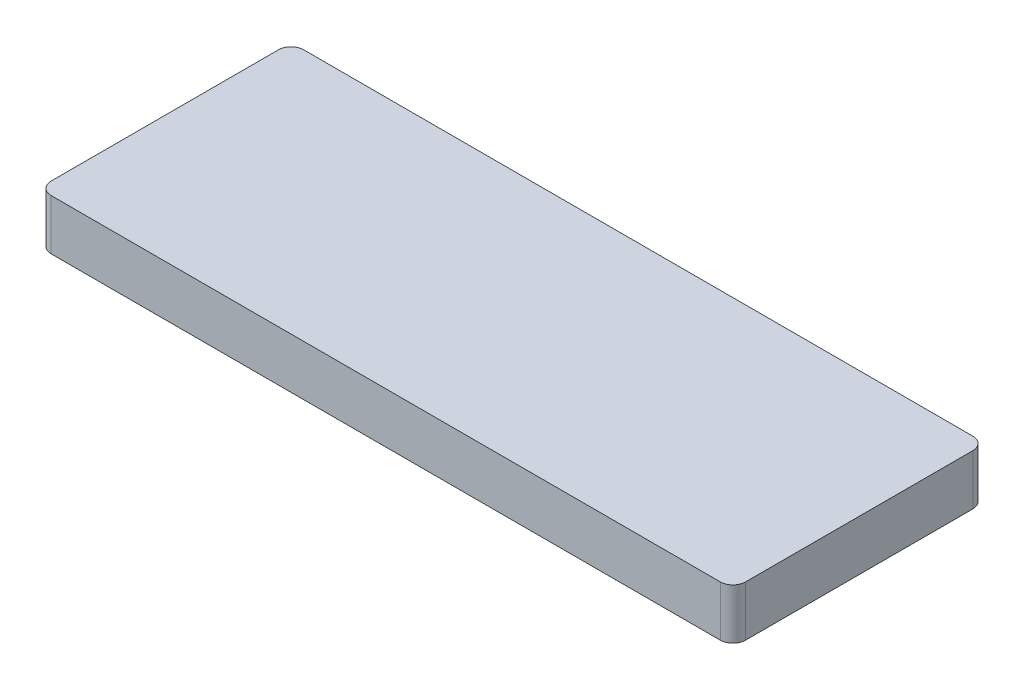
from build123d import *

# Parameters (mm, degrees)
SKETCH1_W           = 34.925
SKETCH1_H           = 12.7
BOSS_EXTRUDE1_DEPTH = 2.54
FILLET1_R           = 0.635
SHELL1_START        = 0.635
SHELL1_OUTLINE_W    = 1.905
SHELL1_OUTLINE_H    = 11.43
SHELL1_DEPTH        = 33.655
SKETCH2_R           = 2.54
BOSS_EXTRUDE2_DEPTH = 1.905


# Read off the part's stored shape, not the designer's step: Shell1
with BuildPart() as part:
    # Sketch1 → Boss-Extrude1 (new body)
    with BuildSketch(Plane(origin=(0, 0, 0), x_dir=(1, 0, 0), z_dir=(0, 1, 0))):
        with Locations((17.4625, 6.35)):
            Rectangle(SKETCH1_W, SKETCH1_H)
    extrude(amount=BOSS_EXTRUDE1_DEPTH)

    # Fillet1
    fillet1_edges = [part.edges().sort_by_distance(p)[0] for p in [
        (0, 1.27, -12.7),
        (34.925, 1.27, -12.7),
        (34.925, 1.27, 0),
        (0, 1.27, 0),
    ]]
    fillet(fillet1_edges, radius=FILLET1_R)

    # Shell1 outline → Shell1 (cut)
    with BuildSketch(Plane.YZ.offset(SHELL1_START)):
        with Locations((0.9525, -6.35)):
            Rectangle(SHELL1_OUTLINE_W, SHELL1_OUTLINE_H)
    extrude(amount=SHELL1_DEPTH, mode=Mode.SUBTRACT)

    # Sketch2 → Boss-Extrude2 (add)
    with BuildSketch(Plane(origin=(0, 1.905, 0), x_dir=(-1, 0, 0), z_dir=(0, -1, 0))):
        with Locations(Location((-17.4625, 6.35, 0), (0, 0, 270))):
            Circle(SKETCH2_R)
    extrude(amount=BOSS_EXTRUDE2_DEPTH)


solid = part.part
